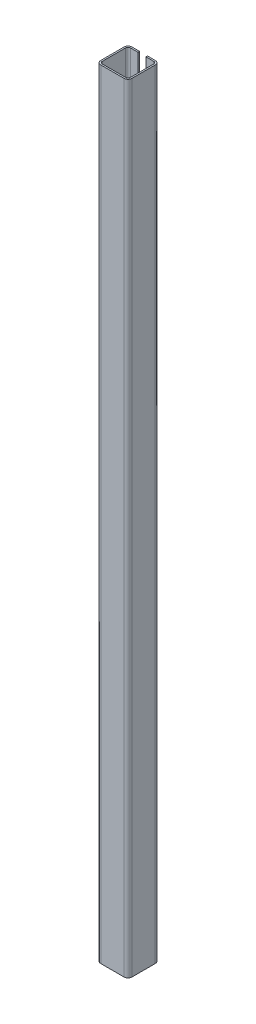
from build123d import *

# Parameters (mm, degrees)
EXTRUDE_1_DEPTH = 1000


with BuildPart() as part:
    # Эскиз1 → Вытянуть-Тонкостенный1 (new body)
    with BuildSketch(Plane(origin=(0, 0, 0), x_dir=(1, 0, 0), z_dir=(0, 1, 0))):
        with BuildLine():
            Line((-5, 40), (-15, 40))
            ThreePointArc((-15, 40), (-18.535533906, 38.535533906), (-20, 35))
            Line((-20, 35), (-20, 5))
            ThreePointArc((-20, 5), (-18.535533906, 1.464466094), (-15, 0))
            Line((-15, 0), (15, 0))
            ThreePointArc((15, 0), (18.535533906, 1.464466094), (20, 5))
            Line((20, 5), (20, 35))
            ThreePointArc((20, 35), (18.535533906, 38.535533906), (15, 40))
            Line((15, 40), (5, 40))
            Line((5, 40), (5, 38))
            Line((5, 38), (15, 38))
            ThreePointArc((15, 38), (17.121320344, 37.121320344), (18, 35))
            Line((18, 35), (18, 5))
            ThreePointArc((18, 5), (17.121320344, 2.878679656), (15, 2))
            Line((15, 2), (-15, 2))
            ThreePointArc((-15, 2), (-17.121320344, 2.878679656), (-18, 5))
            Line((-18, 5), (-18, 35))
            ThreePointArc((-18, 35), (-17.121320344, 37.121320344), (-15, 38))
            Line((-15, 38), (-5, 38))
            Line((-5, 38), (-5, 40))
        make_face()
    extrude(amount=EXTRUDE_1_DEPTH)


solid = part.part
